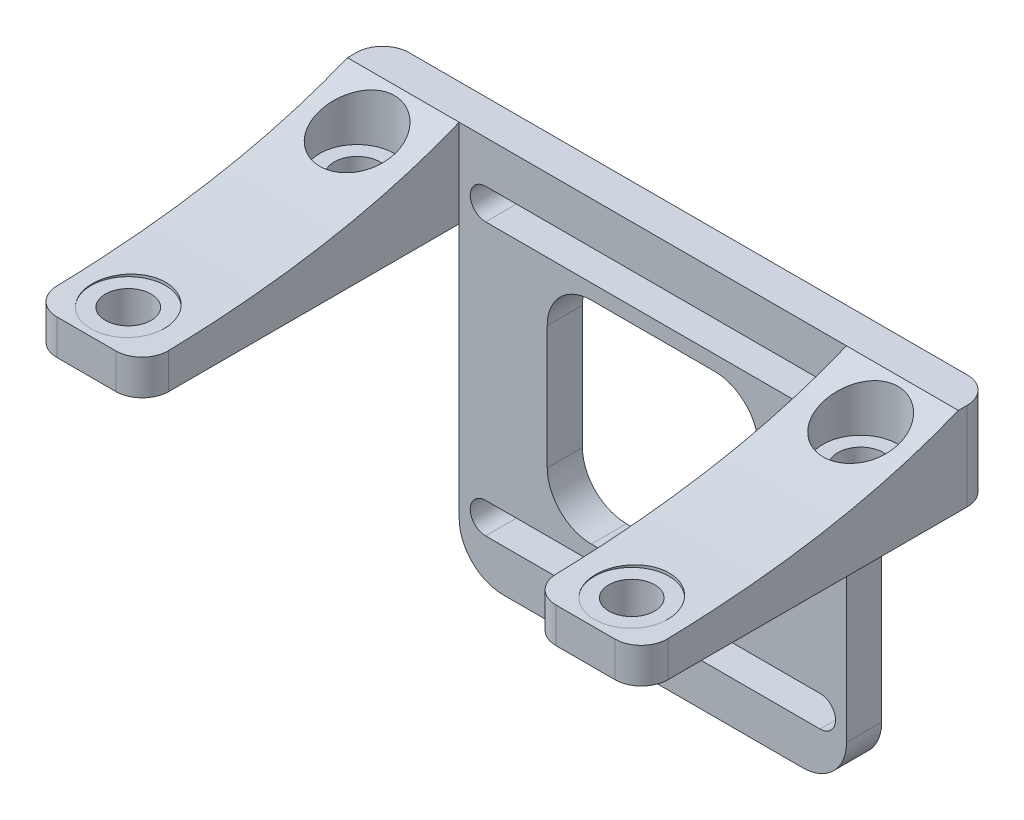
from build123d import *

# Parameters (mm, degrees)
SKETCH1_W           = 44
SKETCH1_H           = 44
BOSS_EXTRUDE1_DEPTH = 4
BOSS_EXTRUDE2_DEPTH = 12.7
SKETCH3_R           = 2.6
CUT_EXTRUDE1_DEPTH  = 63.929246102
SKETCH4_R           = 4.25
CUT_EXTRUDE2_DEPTH  = 66.177373489
FILLET1_R           = 3
FILLET2_R           = 5


with BuildPart() as part:
    # Sketch1 → Boss-Extrude1 (new body)
    with BuildSketch(Plane.XY):
        Rectangle(SKETCH1_W, SKETCH1_H)
        with BuildLine():
            Line((7, 12), (-7, 12))
            ThreePointArc((-7, 12), (-10.535533906, 10.535533906), (-12, 7))
            Line((-12, 7), (-12, -7))
            ThreePointArc((-12, -7), (-10.535533906, -10.535533906), (-7, -12))
            Line((-7, -12), (7, -12))
            ThreePointArc((7, -12), (10.535533906, -10.535533906), (12, -7))
            Line((12, -7), (12, 7))
            ThreePointArc((12, 7), (10.535533906, 10.535533906), (7, 12))
        make_face(mode=Mode.SUBTRACT)
        with BuildLine():
            Line((-19, 17.2), (19, 17.2))
            ThreePointArc((19, 17.2), (20.75, 15.45), (19, 13.7))
            Line((19, 13.7), (-19, 13.7))
            ThreePointArc((-19, 13.7), (-20.75, 15.45), (-19, 17.2))
        make_face(mode=Mode.SUBTRACT)
        with BuildLine():
            Line((-19, -17.2), (19, -17.2))
            ThreePointArc((19, -17.2), (20.75, -15.45), (19, -13.7))
            Line((19, -13.7), (-19, -13.7))
            ThreePointArc((-19, -13.7), (-20.75, -15.45), (-19, -17.2))
        make_face(mode=Mode.SUBTRACT)
    extrude(amount=BOSS_EXTRUDE1_DEPTH)

    # Sketch2 → Boss-Extrude2 (add)
    with BuildSketch(Plane(origin=(22, 0, 0), x_dir=(0, 0, -1), z_dir=(1, 0, 0))):
        with BuildLine():
            Line((0, 12), (-40, 12))
            Line((-40, 12), (-40, 16))
            add(Edge.make_bspline(
                [(-40, 16), (-18.32972451, 16.119369884), (-4, 22)],
                knots=[0, 0, 0, 1, 1, 1], degree=2))
            Line((-4, 22), (0, 22))
            Line((0, 22), (0, 12))
        make_face()
    boss_extrude2 = extrude(amount=BOSS_EXTRUDE2_DEPTH)

    # Sketch3 → Cut-Extrude1 (cut, through all)
    with BuildSketch(Plane.XZ.offset(-12)):
        with Locations((28.6, 35)):
            Circle(SKETCH3_R)
        with Locations((28.6, 9)):
            Circle(SKETCH3_R)
    cut_extrude1 = extrude(amount=-CUT_EXTRUDE1_DEPTH, mode=Mode.SUBTRACT)

    # Sketch4 → Cut-Extrude2 (cut, through all)
    with BuildSketch(Plane(origin=(0, 16, 0), x_dir=(-1, 0, 0), z_dir=(0, -1, 0))):
        with Locations((-28.6, -9)):
            Circle(SKETCH4_R)
        with Locations((-28.6, -35)):
            Circle(SKETCH4_R)
    cut_extrude2 = extrude(amount=-CUT_EXTRUDE2_DEPTH, mode=Mode.SUBTRACT)

    # Mirror1: Boss-Extrude2, Cut-Extrude1, Cut-Extrude2 across plane
    add(boss_extrude2.mirror(Plane(origin=(0, 0, 0), x_dir=(0, 0, 1), z_dir=(1, 0, 0))))
    add(cut_extrude1.mirror(Plane(origin=(0, 0, 0), x_dir=(0, 0, 1), z_dir=(1, 0, 0))), mode=Mode.SUBTRACT)
    add(cut_extrude2.mirror(Plane(origin=(0, 0, 0), x_dir=(0, 0, 1), z_dir=(1, 0, 0))), mode=Mode.SUBTRACT)

    # Fillet1
    fillet1_edges = [part.edges().sort_by_distance(p)[0] for p in [
        (34.7, 17, 0),
        (-34.7, 17, 0),
        (34.7, 14, 40),
        (22, 14, 40),
        (-22, 14, 40),
        (-34.7, 14, 40),
    ]]
    fillet(fillet1_edges, radius=FILLET1_R)

    # Fillet2
    fillet2_edges = [part.edges().sort_by_distance(p)[0] for p in [
        (22, -22, 2),
        (-22, -22, 2),
    ]]
    fillet(fillet2_edges, radius=FILLET2_R)


solid = part.part
